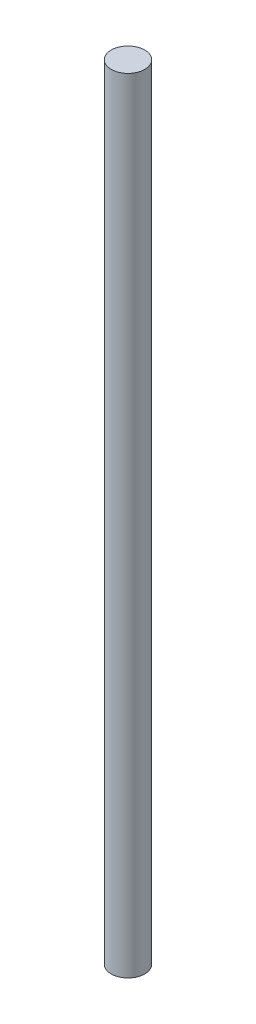
from build123d import *

# Parameters (mm, degrees)
SKETCH1_R           = 1.5
BOSS_EXTRUDE1_DEPTH = 70


with BuildPart() as part:
    # Sketch1 → Boss-Extrude1 (new body)
    with BuildSketch(Plane(origin=(0, 0, 0), x_dir=(1, 0, 0), z_dir=(0, 1, 0))):
        Circle(SKETCH1_R)
    extrude(amount=BOSS_EXTRUDE1_DEPTH)


solid = part.part
